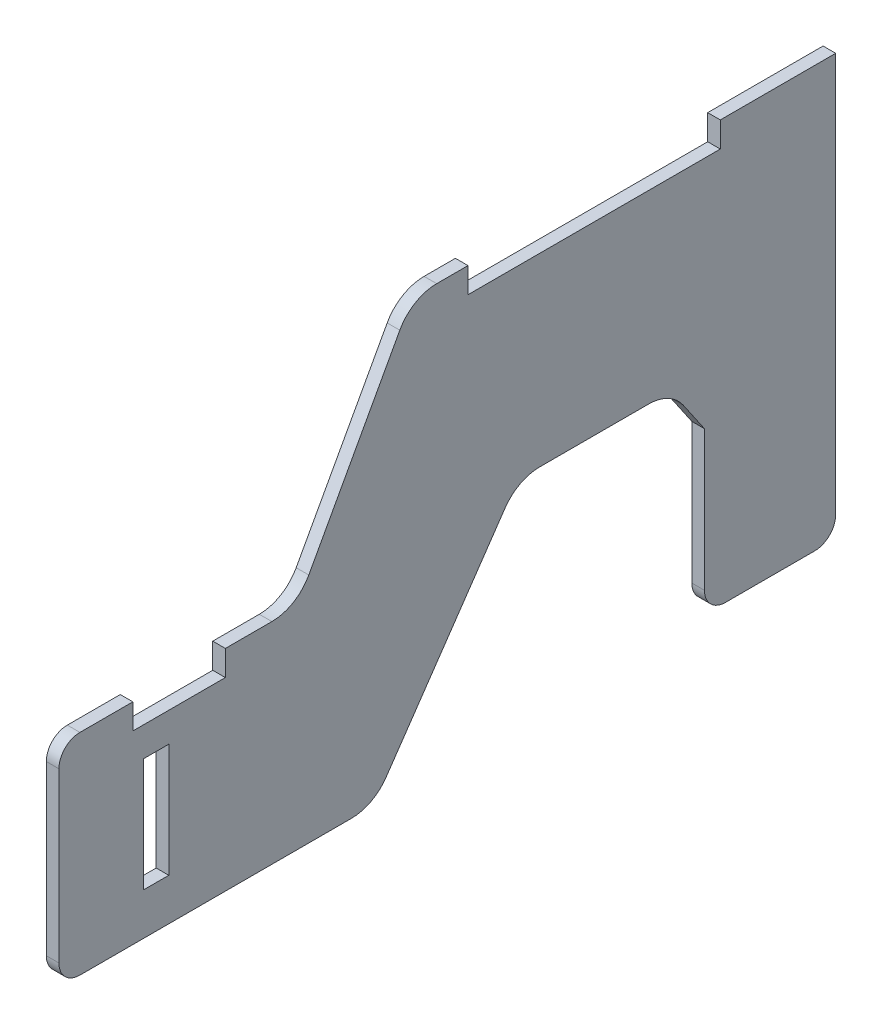
from build123d import *

# Parameters (mm, degrees)
SKETCH2_W           = 6
SKETCH2_H           = 27
BOSS_EXTRUDE1_DEPTH = 3
CUT_EXTRUDE1_DEPTH  = 10
BOSS_EXTRUDE2_DEPTH = 3


with BuildPart() as part:
    # Sketch2 → Boss-Extrude1 (new body)
    with BuildSketch(Plane(origin=(0, 0, 0), x_dir=(0, 0, -1), z_dir=(1, 0, 0))):
        with BuildLine():
            Line((54.431375824, -85.498776043), (76.073962317, -45.905868036))
            ThreePointArc((76.073962317, -45.905868036), (79.747828683, -42.101027368), (84.848586468, -40.70232204))
            Line((84.848586468, -40.70232204), (92.296503371, -40.70232204))
            Line((92.296503371, -40.70232204), (92.296503371, -46.70232204))
            Line((92.296503371, -46.70232204), (152.296503371, -46.70232204))
            Line((152.296503371, -46.70232204), (152.296503371, -40.70232204))
            Line((152.296503371, -40.70232204), (159.744420274, -40.70232204))
            ThreePointArc((159.744420274, -40.70232204), (164.845178059, -42.101027368), (168.519044425, -45.905868036))
            Line((168.519044425, -45.905868036), (190.161630918, -85.498776043))
            ThreePointArc((190.161630918, -85.498776043), (193.835497284, -89.303616711), (198.936255069, -90.70232204))
            Line((198.936255069, -90.70232204), (204.971144594, -90.70232204))
            Line((204.971144594, -90.70232204), (210.00603412, -90.70232204))
            Line((210.00603412, -90.70232204), (210.00603412, -96.70232204))
            Line((210.00603412, -96.70232204), (232.00603412, -96.70232204))
            Line((232.00603412, -96.70232204), (232.00603412, -90.70232204))
            Line((232.00603412, -90.70232204), (246.024997697, -90.70232204))
            ThreePointArc((246.024997697, -90.70232204), (249.649333848, -92.257879057), (251.018525386, -95.956647054))
            Line((251.018525386, -95.956647054), (248.981288141, -135.956647054))
            ThreePointArc((248.981288141, -135.956647054), (247.432203435, -139.326658191), (243.987760452, -140.70232204))
            Line((243.987760452, -140.70232204), (180.035244387, -140.70232204))
            ThreePointArc((180.035244387, -140.70232204), (175.373005086, -139.548989474), (171.786188267, -136.355026979))
            Line((171.786188267, -136.355026979), (143.481459699, -95.0496171))
            ThreePointArc((143.481459699, -95.0496171), (139.89464288, -91.855654605), (135.232403578, -90.70232204))
            Line((135.232403578, -90.70232204), (109.360603164, -90.70232204))
            ThreePointArc((109.360603164, -90.70232204), (104.698363862, -91.855654605), (101.111547043, -95.0496171))
            Line((101.111547043, -95.0496171), (72.806818475, -136.355026979))
            ThreePointArc((72.806818475, -136.355026979), (69.220001657, -139.548989474), (64.557762355, -140.70232204))
            Line((64.557762355, -140.70232204), (0, -140.70232204))
            ThreePointArc((0, -140.70232204), (-3.535533906, -139.237855945), (-5, -135.70232204))
            Line((-5, -135.70232204), (-5, -95.70232204))
            ThreePointArc((-5, -95.70232204), (-3.535533906, -92.166788134), (0, -90.70232204))
            Line((0, -90.70232204), (12.586972622, -90.70232204))
            Line((12.586972622, -90.70232204), (12.586972622, -96.70232204))
            Line((12.586972622, -96.70232204), (34.586972622, -96.70232204))
            Line((34.586972622, -96.70232204), (34.586972622, -90.70232204))
            Line((34.586972622, -90.70232204), (39.621862148, -90.70232204))
            Line((39.621862148, -90.70232204), (45.656751673, -90.70232204))
            ThreePointArc((45.656751673, -90.70232204), (50.757509458, -89.303616711), (54.431375824, -85.498776043))
        make_face()
        with Locations((226.463006742, -117.20232204)):
            Rectangle(SKETCH2_W, SKETCH2_H, mode=Mode.SUBTRACT)
        with Locations((18.13, -117.20232204)):
            Rectangle(SKETCH2_W, SKETCH2_H, mode=Mode.SUBTRACT)
    extrude(amount=BOSS_EXTRUDE1_DEPTH)

    # Sketch3 → Cut-Extrude1 (cut)
    with BuildSketch(Plane(origin=(0, 0, 0), x_dir=(0, 0, -1), z_dir=(1, 0, 0))):
        Polygon((159.744420274, -40.70232204), (159.744420274, -144.460869934), (257.875348239, -144.460869934), (257.875348239, -25.544082069), (159.744420274, -34.903829247), align=None)
    extrude(amount=CUT_EXTRUDE1_DEPTH, mode=Mode.SUBTRACT)

    # Sketch4 → Boss-Extrude2 (add)
    with BuildSketch(Plane(origin=(0, 0, 0), x_dir=(0, 0, -1), z_dir=(1, 0, 0))):
        with BuildLine():
            Line((159.744420274, -40.70232204), (179.744420274, -40.70232204))
            Line((179.744420274, -40.70232204), (179.744420274, -135.70232204))
            ThreePointArc((179.744420274, -135.70232204), (178.27995418, -139.237855945), (174.744420274, -140.70232204))
            Line((174.744420274, -140.70232204), (153.525004458, -140.70232204))
            ThreePointArc((153.525004458, -140.70232204), (149.989470552, -139.237855945), (148.525004458, -135.70232204))
            Line((148.525004458, -135.70232204), (148.525004458, -102.409718895))
            Line((148.525004458, -102.409718895), (159.744420274, -40.70232204))
        make_face()
    extrude(amount=BOSS_EXTRUDE2_DEPTH)


solid = part.part
